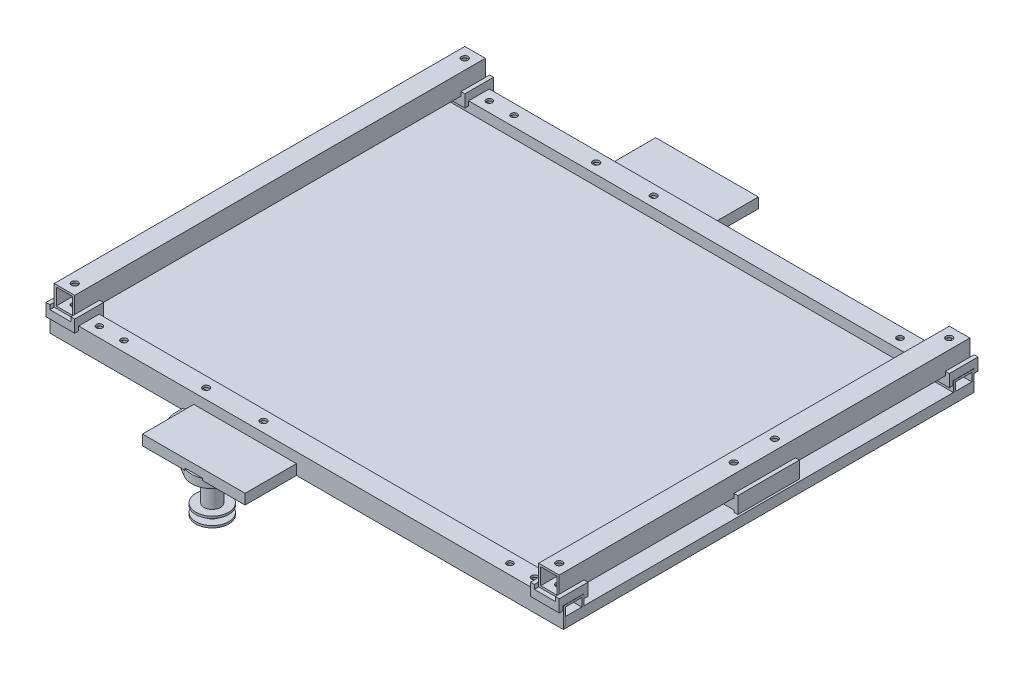
from build123d import *

# Parameters (mm, degrees)
SKETCH_1_W                   = 250
SKETCH_1_H                   = 200
EXTRUDE_1_DEPTH              = 5
SKETCH_2_R                   = 1.5
CUT_EXTRUDE_1_DEPTH          = 161.15617378
SKETCH_3_W                   = 50
SKETCH_3_H                   = 25
EXTRUDE_2_DEPTH              = 5
SKETCH_5_W                   = 10
SKETCH_5_H                   = 10
SKETCH_5_W_2                 = 8
SKETCH_5_H_2                 = 8
EXTRUDE_3_DEPTH              = 250
CUT_EXTRUDE_2_DEPTH          = 177.847391838
CUT_EXTRUDE_2_DEPTH_BACK     = 177.847391838
SKETCH_2_2_R                 = 1.5
SKETCH_7_R                   = 3
SKETCH_7_R_2                 = 1.5
EXTRUDE_4_DEPTH              = 10
SKETCH_7_3_R                 = 3
SKETCH_7_3_R_2               = 1.5
EXTRUDE_5_DEPTH              = 20
SKETCH_7_4_R                 = 4
SKETCH_7_4_R_2               = 3
EXTRUDE_6_DEPTH              = 6
SKETCH_7_5_R                 = 4
SKETCH_7_5_R_2               = 3
EXTRUDE_7_DEPTH              = 16
SKETCH_14_R                  = 8
SKETCH_14_R_2                = 3
EXTRUDE_8_DEPTH              = 1
SKETCH_15_R                  = 8
SKETCH_15_R_2                = 3
EXTRUDE_9_DEPTH              = 1
EXTRUDE_START                = 7
SKETCH_7_6_R                 = 4
SKETCH_7_6_R_2               = 3
EXTRUDE_10_DEPTH             = 3
EXTRUDE_START_2              = 17
SKETCH_7_7_R                 = 4
SKETCH_7_7_R_2               = 3
EXTRUDE_11_DEPTH             = 3
SKETCH_16_R                  = 8
SKETCH_16_R_2                = 1.5
EXTRUDE_12_DEPTH             = 1
SKETCH_17_R                  = 8
SKETCH_17_R_2                = 1.5
EXTRUDE_13_DEPTH             = 1
SKETCH_18_R                  = 1.5
EXTRUDE_14_DEPTH             = 1
SKETCH_18_W                  = 40
SKETCH_18_H                  = 4
EXTRUDE_14_2_DEPTH           = 1
SKETCH_19_R                  = 4.1
EXTRUDE_15_DEPTH             = 3
SKETCH_24_W                  = 1.6
SKETCH_24_H                  = 13
HOLE_WIZARD_M3_1_AT_2_COUNT  = 2
HOLE_WIZARD_M3_1_AT_2_PITCH  = 28
OTHER_START                  = -0.1
OTHER_5_OUTLINE_W            = 40
OTHER_5_OUTLINE_H            = 10.2
OTHER_5_OUTLINE_R            = 1.6
OTHER_5_DEPTH                = 1.1
SKETCH_25_W                  = 10
SKETCH_25_H                  = 10
SKETCH_25_W_2                = 8
SKETCH_25_H_2                = 8
EXTRUDE_16_DEPTH             = 200
EXTRUDE_16_2_DEPTH           = 200
SKETCH_26_W                  = 14
SKETCH_26_H                  = 14
EXTRUDE_18_DEPTH             = 2
SKETCH_27_W                  = 2
SKETCH_27_H                  = 14
EXTRUDE_19_DEPTH             = 2
SKETCH_28_W                  = 14
SKETCH_28_H                  = 2
EXTRUDE_20_DEPTH             = 2
OTHER_START_2                = 10
OTHER_3_OUTLINE_W            = 14
OTHER_3_OUTLINE_H            = 10.2
OTHER_3_DEPTH                = 0.1
OTHER_START_3                = 11.9
OTHER_3_2_OUTLINE_W          = 10.2
OTHER_3_2_OUTLINE_H          = 12.1
OTHER_3_2_DEPTH              = 0.1
OTHER_START_4                = 8
OTHER_3_3_OUTLINE_W          = 14
OTHER_3_3_OUTLINE_H          = 0.1
OTHER_3_3_DEPTH              = 2
OTHER_START_5                = 12
OTHER_3_4_OUTLINE_W          = 0.1
OTHER_3_4_OUTLINE_H          = 12.1
OTHER_3_4_DEPTH              = 2
CUT_EXTRUDE_3_DEPTH          = 1.9
EXTRUDE_21_DEPTH             = 15
HOLE_START                   = 7
HOLE_WIZARD_M3_2_OUTLINE_R   = 1.6
HOLE_WIZARD_M3_2_DEPTH       = 4.9
HOLE_START_2                 = 10.1
HOLE_WIZARD_M3_2_2_OUTLINE_R = 1.6
HOLE_WIZARD_M3_2_2_DEPTH     = 1.8
HOLE_WIZARD_M3_2_3_OUTLINE_R = 1.6
HOLE_WIZARD_M3_2_3_DEPTH     = 1.8
HOLE_WIZARD_M3_2_4_OUTLINE_R = 1.6
HOLE_WIZARD_M3_2_4_DEPTH     = 1.8
HOLE_WIZARD_M3_2_5_OUTLINE_R = 1.6
HOLE_WIZARD_M3_2_5_DEPTH     = 1.8
HOLE_START_3                 = 12
HOLE_WIZARD_M3_2_6_OUTLINE_R = 1.6
HOLE_WIZARD_M3_2_6_DEPTH     = 10
HOLE_WIZARD_M3_2_7_OUTLINE_R = 1.6
HOLE_WIZARD_M3_2_7_DEPTH     = 10
HOLE_WIZARD_M3_2_8_OUTLINE_R = 1.6
HOLE_WIZARD_M3_2_8_DEPTH     = 10
HOLE_WIZARD_M3_2_9_OUTLINE_R = 1.6
HOLE_WIZARD_M3_2_9_DEPTH     = 10


# Read off the part's stored shape, not the designer's step: ｲﾝﾃﾞﾝﾄ5, ｲﾝﾃﾞﾝﾄ3, M3 すきま穴2
with BuildPart() as part:
    # ｽｹｯﾁ1 → ﾎﾞｽ - 押し出し1 (new body)
    with BuildSketch(Plane(origin=(0, 0, 0), x_dir=(1, 0, 0), z_dir=(0, 1, 0))):
        Rectangle(SKETCH_1_W, SKETCH_1_H)
    extrude(amount=EXTRUDE_1_DEPTH)

    # ｽｹｯﾁ2 → ｶｯﾄ - 押し出し1 (cut, through all)
    with BuildSketch(Plane(origin=(0, 5, 0), x_dir=(1, 0, 0), z_dir=(0, 1, 0))):
        with Locations(Location((-106, 95, 0), (0, 0, 270))):
            Circle(SKETCH_2_R)
        with Locations(Location((-94, 95, 0), (0, 0, 270))):
            Circle(SKETCH_2_R)
        with Locations(Location((-94, -95, 0), (0, 0, 90))):
            Circle(SKETCH_2_R)
        with Locations(Location((-106, -95, 0), (0, 0, 90))):
            Circle(SKETCH_2_R)
        with Locations(Location((94, 95, 0), (0, 0, 90))):
            Circle(SKETCH_2_R)
        with Locations(Location((106, 95, 0), (0, 0, 90))):
            Circle(SKETCH_2_R)
        with Locations(Location((94, -95, 0), (0, 0, 270))):
            Circle(SKETCH_2_R)
        with Locations(Location((106, -95, 0), (0, 0, 270))):
            Circle(SKETCH_2_R)
    extrude(amount=-CUT_EXTRUDE_1_DEPTH, mode=Mode.SUBTRACT)

    # ｽｹｯﾁ3 → ﾎﾞｽ - 押し出し2 (add)
    with BuildSketch(Plane(origin=(0, 5, 0), x_dir=(1, 0, 0), z_dir=(0, 1, 0))):
        with Locations((-30, 112.5)):
            Rectangle(SKETCH_3_W, SKETCH_3_H)
        with Locations((-30, -112.5)):
            Rectangle(SKETCH_3_W, SKETCH_3_H)
    extrude(amount=-EXTRUDE_2_DEPTH)


with BuildPart() as body_2:
    # ｽｹｯﾁ5 → ﾎﾞｽ - 押し出し3 (new body)
    with BuildSketch(Plane.ZY.offset(125)):
        with Locations((95, 5)):
            Rectangle(SKETCH_5_W, SKETCH_5_H)
        with Locations((95, 5)):
            Rectangle(SKETCH_5_W_2, SKETCH_5_H_2, mode=Mode.SUBTRACT)
    extrude(amount=-EXTRUDE_3_DEPTH)


with BuildPart() as body_3:
    # ﾐﾗｰ1: mirrored copy
    add(body_2.part.mirror(Plane.XY))


with BuildPart() as cut_extrude_2_tool:
    # ｽｹｯﾁ2<2> → ｶｯﾄ - 押し出し2 (new, two sides: drawn at the far end of the back side and taken through both)
    with BuildSketch(Plane(origin=(0, 5, 0), x_dir=(1, 0, 0), z_dir=(0, 1, 0)).offset(-CUT_EXTRUDE_2_DEPTH_BACK)):
        with Locations(Location((-106, 95, 0), (0, 0, 270))):
            Circle(SKETCH_2_2_R)
        with Locations(Location((-94, 95, 0), (0, 0, 270))):
            Circle(SKETCH_2_2_R)
        with Locations(Location((-94, -95, 0), (0, 0, 270))):
            Circle(SKETCH_2_2_R)
        with Locations(Location((-106, -95, 0), (0, 0, 270))):
            Circle(SKETCH_2_2_R)
        with Locations(Location((94, 95, 0), (0, 0, 270))):
            Circle(SKETCH_2_2_R)
        with Locations(Location((106, 95, 0), (0, 0, 270))):
            Circle(SKETCH_2_2_R)
        with Locations(Location((94, -95, 0), (0, 0, 270))):
            Circle(SKETCH_2_2_R)
        with Locations(Location((106, -95, 0), (0, 0, 270))):
            Circle(SKETCH_2_2_R)
    extrude(amount=CUT_EXTRUDE_2_DEPTH + CUT_EXTRUDE_2_DEPTH_BACK)


with BuildPart() as body_2_1:
    add(body_2.part)

    # ｶｯﾄ - 押し出し2: cut by cut_extrude_2_tool
    add(cut_extrude_2_tool.part, mode=Mode.SUBTRACT)


with BuildPart() as body_3_1:
    add(body_3.part)

    # ｶｯﾄ - 押し出し2: cut by cut_extrude_2_tool
    add(cut_extrude_2_tool.part, mode=Mode.SUBTRACT)

    # Hole Wizard M3 _2 8 outline → Hole Wizard M3 _2 8 (cut)
    with BuildSketch(Plane(origin=(0, 0, 0), x_dir=(1, 0, 0), z_dir=(0, 1, 0))):
        with Locations((-118, 95)):
            Circle(HOLE_WIZARD_M3_2_8_OUTLINE_R)
        with Locations((118, 95)):
            Circle(HOLE_WIZARD_M3_2_8_OUTLINE_R)
        with Locations((-54, 95)):
            Circle(HOLE_WIZARD_M3_2_8_OUTLINE_R)
        with Locations((-26, 95)):
            Circle(HOLE_WIZARD_M3_2_8_OUTLINE_R)
    extrude(amount=HOLE_WIZARD_M3_2_8_DEPTH, mode=Mode.SUBTRACT)


with BuildPart() as body_4:
    # ｽｹｯﾁ7 → ﾎﾞｽ - 押し出し4 (new body)
    with BuildSketch(Plane.XZ):
        with Locations(Location((-50, 104, 0), (0, 0, 270))):
            Circle(SKETCH_7_R)
        with Locations(Location((-50, 104, 0), (0, 0, 270))):
            Circle(SKETCH_7_R_2, mode=Mode.SUBTRACT)
    extrude(amount=EXTRUDE_4_DEPTH)


with BuildPart() as body_5:
    # ｽｹｯﾁ7<3> → ﾎﾞｽ - 押し出し5 (new body)
    with BuildSketch(Plane.XZ):
        with Locations(Location((-30, 116, 0), (0, 0, 270))):
            Circle(SKETCH_7_3_R)
        with Locations(Location((-30, 116, 0), (0, 0, 270))):
            Circle(SKETCH_7_3_R_2, mode=Mode.SUBTRACT)
    extrude(amount=EXTRUDE_5_DEPTH)


with BuildPart() as body_6:
    # ｽｹｯﾁ7<4> → ﾎﾞｽ - 押し出し6 (new body)
    with BuildSketch(Plane.XZ):
        with Locations(Location((-50, 104, 0), (0, 0, 270))):
            Circle(SKETCH_7_4_R)
        with Locations(Location((-50, 104, 0), (0, 0, 270))):
            Circle(SKETCH_7_4_R_2, mode=Mode.SUBTRACT)
    extrude(amount=EXTRUDE_6_DEPTH)


with BuildPart() as body_7:
    # ｽｹｯﾁ7<5> → ﾎﾞｽ - 押し出し7 (new body)
    with BuildSketch(Plane.XZ):
        with Locations(Location((-30, 116, 0), (0, 0, 270))):
            Circle(SKETCH_7_5_R)
        with Locations(Location((-30, 116, 0), (0, 0, 270))):
            Circle(SKETCH_7_5_R_2, mode=Mode.SUBTRACT)
    extrude(amount=EXTRUDE_7_DEPTH)


with BuildPart() as body_8:
    # ｽｹｯﾁ14 → ﾎﾞｽ - 押し出し8 (new body)
    with BuildSketch(Plane.XZ.offset(6)):
        with Locations(Location((-50, 104, 0), (0, 0, 270))):
            Circle(SKETCH_14_R)
        with Locations(Location((-50, 104, 0), (0, 0, 270))):
            Circle(SKETCH_14_R_2, mode=Mode.SUBTRACT)
    extrude(amount=EXTRUDE_8_DEPTH)


with BuildPart() as body_9:
    # ｽｹｯﾁ15 → ﾎﾞｽ - 押し出し9 (new body)
    with BuildSketch(Plane.XZ.offset(16)):
        with Locations(Location((-30, 116, 0), (0, 0, 270))):
            Circle(SKETCH_15_R)
        with Locations(Location((-30, 116, 0), (0, 0, 270))):
            Circle(SKETCH_15_R_2, mode=Mode.SUBTRACT)
    extrude(amount=EXTRUDE_9_DEPTH)


with BuildPart() as body_10:
    # ｽｹｯﾁ7<6> → ﾎﾞｽ - 押し出し10 (new body)
    with BuildSketch(Plane.XZ.offset(EXTRUDE_START)):
        with Locations(Location((-50, 104, 0), (0, 0, 270))):
            Circle(SKETCH_7_6_R)
        with Locations(Location((-50, 104, 0), (0, 0, 270))):
            Circle(SKETCH_7_6_R_2, mode=Mode.SUBTRACT)
    extrude(amount=EXTRUDE_10_DEPTH)


with BuildPart() as body_11:
    # ｽｹｯﾁ7<7> → ﾎﾞｽ - 押し出し11 (new body)
    with BuildSketch(Plane.XZ.offset(EXTRUDE_START_2)):
        with Locations(Location((-30, 116, 0), (0, 0, 270))):
            Circle(SKETCH_7_7_R)
        with Locations(Location((-30, 116, 0), (0, 0, 270))):
            Circle(SKETCH_7_7_R_2, mode=Mode.SUBTRACT)
    extrude(amount=EXTRUDE_11_DEPTH)


with BuildPart() as body_12:
    # ｽｹｯﾁ16 → ﾎﾞｽ - 押し出し12 (new body)
    with BuildSketch(Plane.XZ.offset(10)):
        with Locations(Location((-50, 104, 0), (0, 0, 270))):
            Circle(SKETCH_16_R)
        with Locations(Location((-50, 104, 0), (0, 0, 270))):
            Circle(SKETCH_16_R_2, mode=Mode.SUBTRACT)
    extrude(amount=EXTRUDE_12_DEPTH)


with BuildPart() as body_13:
    # ｽｹｯﾁ17 → ﾎﾞｽ - 押し出し13 (new body)
    with BuildSketch(Plane.XZ.offset(20)):
        with Locations(Location((-30, 116, 0), (0, 0, 270))):
            Circle(SKETCH_17_R)
        with Locations(Location((-30, 116, 0), (0, 0, 270))):
            Circle(SKETCH_17_R_2, mode=Mode.SUBTRACT)
    extrude(amount=EXTRUDE_13_DEPTH)


with BuildPart() as body_14:
    # ｽｹｯﾁ18 → ﾎﾞｽ - 押し出し14 (new body)
    with BuildSketch(Plane.XZ):
        with BuildLine():
            Line((-60, 100), (-60, 104))
            ThreePointArc((-60, 104), (-58.701999068, 108.92698815), (-55.144957554, 112.574929257))
            Line((-55.144957554, 112.574929257), (-35.144957554, 124.574929257))
            ThreePointArc((-35.144957554, 124.574929257), (-25.07301185, 124.701999068), (-20, 116))
            Line((-20, 116), (-20, 100))
            Line((-20, 100), (-60, 100))
        make_face()
        with Locations(Location((-50, 104, 0), (0, 0, 270))):
            Circle(SKETCH_18_R, mode=Mode.SUBTRACT)
        with Locations(Location((-30, 116, 0), (0, 0, 270))):
            Circle(SKETCH_18_R, mode=Mode.SUBTRACT)
    extrude(amount=-EXTRUDE_14_DEPTH)


with BuildPart() as body_15:
    # ｽｹｯﾁ18 → Extrude 14 2 (new body)
    with BuildSketch(Plane.XZ):
        with Locations((-40, 88)):
            Rectangle(SKETCH_18_W, SKETCH_18_H)
    extrude(amount=-EXTRUDE_14_2_DEPTH)


    add(body_14.part)  # ﾎﾞｽ - 押し出し15 merges body 14
    # ｽｹｯﾁ19 → ﾎﾞｽ - 押し出し15 (add)
    with BuildSketch(Plane.XZ):
        with BuildLine():
            Line((-60, 100), (-60, 86))
            Line((-60, 86), (-20, 86))
            Line((-20, 86), (-20, 100))
            Line((-20, 100), (-20, 116))
            ThreePointArc((-20, 116), (-25.07301185, 124.701999068), (-35.144957554, 124.574929257))
            Line((-35.144957554, 124.574929257), (-55.144957554, 112.574929257))
            ThreePointArc((-55.144957554, 112.574929257), (-58.701999068, 108.92698815), (-60, 104))
            Line((-60, 104), (-60, 100))
        make_face()
        with Locations(Location((-30, 116, 0), (0, 0, 270))):
            Circle(SKETCH_19_R, mode=Mode.SUBTRACT)
        with Locations(Location((-50, 104, 0), (0, 0, 257.319616508))):
            Circle(SKETCH_19_R, mode=Mode.SUBTRACT)
    extrude(amount=EXTRUDE_15_DEPTH)


with BuildPart() as hole_wizard_m3_1_tool:
    # ｽｹｯﾁ24 → M3 すきま穴1 (revolve)
    with BuildSketch(Plane(origin=(-54, -3, 95), x_dir=(0, 0, -1), z_dir=(1, 0, 0))):
        with Locations((0.8, 6.5)):
            Rectangle(SKETCH_24_W, SKETCH_24_H)
    hole_wizard_m3_1 = revolve(axis=Axis((-54, -9.35, 95), (0, 1, 0)))


with BuildPart() as body_2_2:
    add(body_2_1.part)

    # M3 すきま穴1: cut by hole_wizard_m3_1_tool
    add(hole_wizard_m3_1_tool.part, mode=Mode.SUBTRACT)


with BuildPart() as body_15_1:
    add(body_15.part)

    # M3 すきま穴1: cut by hole_wizard_m3_1_tool
    add(hole_wizard_m3_1_tool.part, mode=Mode.SUBTRACT)


with BuildPart() as hole_wizard_m3_1_at_2_tool:
    # M3 すきま穴1 at 2: M3 すきま穴1 ×2
    with Locations(*[(i * HOLE_WIZARD_M3_1_AT_2_PITCH, 0, 0) for i in range(1, HOLE_WIZARD_M3_1_AT_2_COUNT)]):
        add(hole_wizard_m3_1)


with BuildPart() as body_2_3:
    add(body_2_2.part)

    # M3 すきま穴1 at 2: cut by hole_wizard_m3_1_at_2_tool
    add(hole_wizard_m3_1_at_2_tool.part, mode=Mode.SUBTRACT)

    # Hole Wizard M3 _2 9 outline → Hole Wizard M3 _2 9 (cut)
    with BuildSketch(Plane(origin=(0, 0, 0), x_dir=(1, 0, 0), z_dir=(0, 1, 0))):
        with Locations((118, -95)):
            Circle(HOLE_WIZARD_M3_2_9_OUTLINE_R)
        with Locations((-118, -95)):
            Circle(HOLE_WIZARD_M3_2_9_OUTLINE_R)
    extrude(amount=HOLE_WIZARD_M3_2_9_DEPTH, mode=Mode.SUBTRACT)


with BuildPart() as body_15_2:
    add(body_15_1.part)

    # M3 すきま穴1 at 2: cut by hole_wizard_m3_1_at_2_tool
    add(hole_wizard_m3_1_at_2_tool.part, mode=Mode.SUBTRACT)

    # ｲﾝﾃﾞﾝﾄ5 outline → ｲﾝﾃﾞﾝﾄ5 (cut)
    with BuildSketch(Plane(origin=(0, 0, 0), x_dir=(1, 0, 0), z_dir=(0, 1, 0)).offset(OTHER_START)):
        with Locations((-40, -95)):
            Rectangle(OTHER_5_OUTLINE_W, OTHER_5_OUTLINE_H)
        with BuildLine():
            ThreePointArc((-50.9, -100), (-50, -99.9), (-49.1, -100))
            Line((-49.1, -100), (-50.9, -100))
        make_face(mode=Mode.SUBTRACT)
        with Locations((-26, -95)):
            Circle(OTHER_5_OUTLINE_R, mode=Mode.SUBTRACT)
        with Locations((-54, -95)):
            Circle(OTHER_5_OUTLINE_R, mode=Mode.SUBTRACT)
    extrude(amount=OTHER_5_DEPTH, mode=Mode.SUBTRACT)


with BuildPart() as body_15_2_1:
    # ｽｹｯﾁ25 → ﾎﾞｽ - 押し出し16 (new body)
    with BuildSketch(Plane.XY.offset(100)):
        with Locations((-118, 17)):
            Rectangle(SKETCH_25_W, SKETCH_25_H)
        with Locations((-118, 17)):
            Rectangle(SKETCH_25_W_2, SKETCH_25_H_2, mode=Mode.SUBTRACT)
    extrude(amount=-EXTRUDE_16_DEPTH)

    # Hole Wizard M3 _2 7 outline → Hole Wizard M3 _2 7 (cut)
    with BuildSketch(Plane(origin=(0, 0, 0), x_dir=(1, 0, 0), z_dir=(0, 1, 0)).offset(HOLE_START_3)):
        with Locations((-118, 95)):
            Circle(HOLE_WIZARD_M3_2_7_OUTLINE_R)
        with Locations((-118, -95)):
            Circle(HOLE_WIZARD_M3_2_7_OUTLINE_R)
    extrude(amount=HOLE_WIZARD_M3_2_7_DEPTH, mode=Mode.SUBTRACT)


with BuildPart() as body_16:
    # ｽｹｯﾁ25 → Extrude 16 2 (new body)
    with BuildSketch(Plane.XY.offset(100)):
        with Locations((118, 17)):
            Rectangle(SKETCH_25_W, SKETCH_25_H)
        with Locations((118, 17)):
            Rectangle(SKETCH_25_W_2, SKETCH_25_H_2, mode=Mode.SUBTRACT)
    extrude(amount=-EXTRUDE_16_2_DEPTH)

    # Hole Wizard M3 _2 6 outline → Hole Wizard M3 _2 6 (cut)
    with BuildSketch(Plane(origin=(0, 0, 0), x_dir=(1, 0, 0), z_dir=(0, 1, 0)).offset(HOLE_START_3)):
        with Locations((118, -10)):
            Circle(HOLE_WIZARD_M3_2_6_OUTLINE_R)
        with Locations((118, 10)):
            Circle(HOLE_WIZARD_M3_2_6_OUTLINE_R)
        with Locations((118, -95)):
            Circle(HOLE_WIZARD_M3_2_6_OUTLINE_R)
        with Locations((118, 95)):
            Circle(HOLE_WIZARD_M3_2_6_OUTLINE_R)
    extrude(amount=HOLE_WIZARD_M3_2_6_DEPTH, mode=Mode.SUBTRACT)


with BuildPart() as body_17:
    # ｽｹｯﾁ26 → ﾎﾞｽ - 押し出し18 (new body)
    with BuildSketch(Plane(origin=(0, 10, 0), x_dir=(1, 0, 0), z_dir=(0, 1, 0))):
        with Locations((-118, -95)):
            Rectangle(SKETCH_26_W, SKETCH_26_H)
    extrude(amount=EXTRUDE_18_DEPTH)

    # ｽｹｯﾁ27 → ﾎﾞｽ - 押し出し19 (add)
    with BuildSketch(Plane(origin=(0, 12, 0), x_dir=(1, 0, 0), z_dir=(0, 1, 0))):
        with Locations((-124, -95)):
            Rectangle(SKETCH_27_W, SKETCH_27_H)
        with Locations((-112, -95)):
            Rectangle(SKETCH_27_W, SKETCH_27_H)
    extrude(amount=EXTRUDE_19_DEPTH)

    # ｽｹｯﾁ28 → ﾎﾞｽ - 押し出し20 (add)
    with BuildSketch(Plane.XZ.offset(-10)):
        with Locations((-118, 101)):
            Rectangle(SKETCH_28_W, SKETCH_28_H)
        with Locations((-118, 89)):
            Rectangle(SKETCH_28_W, SKETCH_28_H)
    extrude(amount=EXTRUDE_20_DEPTH)

    # ｲﾝﾃﾞﾝﾄ3 outline → ｲﾝﾃﾞﾝﾄ3 (cut)
    with BuildSketch(Plane(origin=(0, 0, 0), x_dir=(1, 0, 0), z_dir=(0, 1, 0)).offset(OTHER_START_2)):
        with Locations((-118, -95)):
            Rectangle(OTHER_3_OUTLINE_W, OTHER_3_OUTLINE_H)
    extrude(amount=OTHER_3_DEPTH, mode=Mode.SUBTRACT)

    # Other 3 2 outline → Other 3 2 (cut)
    with BuildSketch(Plane(origin=(0, 0, 0), x_dir=(1, 0, 0), z_dir=(0, 1, 0)).offset(OTHER_START_3)):
        with Locations((-118, -94.05)):
            Rectangle(OTHER_3_2_OUTLINE_W, OTHER_3_2_OUTLINE_H)
    extrude(amount=OTHER_3_2_DEPTH, mode=Mode.SUBTRACT)

    # Other 3 3 outline → Other 3 3 (cut)
    with BuildSketch(Plane(origin=(0, 0, 0), x_dir=(1, 0, 0), z_dir=(0, 1, 0)).offset(OTHER_START_4)):
        with Locations((-118, -89.95)):
            Rectangle(OTHER_3_3_OUTLINE_W, OTHER_3_3_OUTLINE_H)
        with Locations((-118, -100.05)):
            Rectangle(OTHER_3_3_OUTLINE_W, OTHER_3_3_OUTLINE_H)
    extrude(amount=OTHER_3_3_DEPTH, mode=Mode.SUBTRACT)

    # Other 3 4 outline → Other 3 4 (cut)
    with BuildSketch(Plane(origin=(0, 0, 0), x_dir=(1, 0, 0), z_dir=(0, 1, 0)).offset(OTHER_START_5)):
        with Locations((-123.05, -94.05)):
            Rectangle(OTHER_3_4_OUTLINE_W, OTHER_3_4_OUTLINE_H)
        with Locations((-112.95, -94.05)):
            Rectangle(OTHER_3_4_OUTLINE_W, OTHER_3_4_OUTLINE_H)
    extrude(amount=OTHER_3_4_DEPTH, mode=Mode.SUBTRACT)

    # ｽｹｯﾁ35 → ｶｯﾄ - 押し出し3 (cut)
    with BuildSketch(Plane(origin=(0, 0, 100.1), x_dir=(-1, 0, 0), z_dir=(0, 0, -1))):
        Polygon((123, 14), (123, 12), (113, 12), (113, 14), (112.9, 14), (112.9, 11.9), (123.1, 11.9), (123.1, 14), align=None)
    extrude(amount=-CUT_EXTRUDE_3_DEPTH, mode=Mode.SUBTRACT)


with BuildPart() as body_18:
    # ﾐﾗｰ2: mirrored copy
    add(body_17.part.mirror(Plane(origin=(0, 0, 0), x_dir=(0, 0, 1), z_dir=(1, 0, 0))))


with BuildPart() as body_19:
    # ﾐﾗｰ3: mirrored copy
    add(body_17.part.mirror(Plane.XY))

    # Hole Wizard M3 _2 3 outline → Hole Wizard M3 _2 3 (cut)
    with BuildSketch(Plane(origin=(0, 0, 0), x_dir=(1, 0, 0), z_dir=(0, 1, 0)).offset(HOLE_START_2)):
        with Locations((-118, 95)):
            Circle(HOLE_WIZARD_M3_2_3_OUTLINE_R)
    extrude(amount=HOLE_WIZARD_M3_2_3_DEPTH, mode=Mode.SUBTRACT)


with BuildPart() as body_20:
    # Mirror 3 2: mirrored copy
    add(body_9.part.mirror(Plane.XY))


with BuildPart() as body_21:
    # Mirror 3 3: mirrored copy
    add(body_8.part.mirror(Plane.XY))


with BuildPart() as body_22:
    # Mirror 3 4: mirrored copy
    add(body_11.part.mirror(Plane.XY))


with BuildPart() as body_23:
    # Mirror 3 5: mirrored copy
    add(body_7.part.mirror(Plane.XY))


with BuildPart() as body_24:
    # Mirror 3 6: mirrored copy
    add(body_10.part.mirror(Plane.XY))


with BuildPart() as body_25:
    # Mirror 3 7: mirrored copy
    add(body_13.part.mirror(Plane.XY))


with BuildPart() as body_26:
    # Mirror 3 8: mirrored copy
    add(body_5.part.mirror(Plane.XY))


with BuildPart() as body_27:
    # Mirror 3 9: mirrored copy
    add(body_12.part.mirror(Plane.XY))


with BuildPart() as body_28:
    # Mirror 3 10: mirrored copy
    add(body_15_2.part.mirror(Plane.XY))


with BuildPart() as body_29:
    # Mirror 3 11: mirrored copy
    add(body_6.part.mirror(Plane.XY))


with BuildPart() as body_30:
    # Mirror 3 12: mirrored copy
    add(body_18.part.mirror(Plane.XY))

    # Hole Wizard M3 _2 2 outline → Hole Wizard M3 _2 2 (cut)
    with BuildSketch(Plane(origin=(0, 0, 0), x_dir=(1, 0, 0), z_dir=(0, 1, 0)).offset(HOLE_START_2)):
        with Locations((118, 95)):
            Circle(HOLE_WIZARD_M3_2_2_OUTLINE_R)
    extrude(amount=HOLE_WIZARD_M3_2_2_DEPTH, mode=Mode.SUBTRACT)


with BuildPart() as body_31:
    # Mirror 3 13: mirrored copy
    add(body_4.part.mirror(Plane.XY))


with BuildPart() as body_32:
    # ｽｹｯﾁ34 → ﾎﾞｽ - 押し出し21 (new, symmetric)
    with BuildSketch(Plane.XY):
        Polygon((111, 14), (111, 6), (112.9, 6), (112.9, 7), (123.1, 7), (123.1, 6), (125, 6), (125, 14), (123.1, 14), (123.1, 11.9), (112.9, 11.9), (112.9, 14), align=None)
    extrude(amount=EXTRUDE_21_DEPTH, both=True)

    # M3 すきま穴2 outline → M3 すきま穴2 (cut)
    with BuildSketch(Plane(origin=(0, 0, 0), x_dir=(1, 0, 0), z_dir=(0, 1, 0)).offset(HOLE_START)):
        with Locations((118, -10)):
            Circle(HOLE_WIZARD_M3_2_OUTLINE_R)
        with Locations((118, 10)):
            Circle(HOLE_WIZARD_M3_2_OUTLINE_R)
    extrude(amount=HOLE_WIZARD_M3_2_DEPTH, mode=Mode.SUBTRACT)


with BuildPart() as body_18_1:
    add(body_18.part)

    # Hole Wizard M3 _2 4 outline → Hole Wizard M3 _2 4 (cut)
    with BuildSketch(Plane(origin=(0, 0, 0), x_dir=(1, 0, 0), z_dir=(0, 1, 0)).offset(HOLE_START_2)):
        with Locations((118, -95)):
            Circle(HOLE_WIZARD_M3_2_4_OUTLINE_R)
    extrude(amount=HOLE_WIZARD_M3_2_4_DEPTH, mode=Mode.SUBTRACT)


with BuildPart() as body_17_1:
    add(body_17.part)

    # Hole Wizard M3 _2 5 outline → Hole Wizard M3 _2 5 (cut)
    with BuildSketch(Plane(origin=(0, 0, 0), x_dir=(1, 0, 0), z_dir=(0, 1, 0)).offset(HOLE_START_2)):
        with Locations((-118, -95)):
            Circle(HOLE_WIZARD_M3_2_5_OUTLINE_R)
    extrude(amount=HOLE_WIZARD_M3_2_5_DEPTH, mode=Mode.SUBTRACT)


solid = Compound([part.part, body_3_1.part, body_4.part, body_5.part, body_6.part, body_7.part, body_8.part, body_9.part, body_10.part, body_11.part, body_12.part, body_13.part, body_2_3.part, body_15_2.part, body_15_2_1.part, body_16.part, body_19.part, body_20.part, body_21.part, body_22.part, body_23.part, body_24.part, body_25.part, body_26.part, body_27.part, body_28.part, body_29.part, body_30.part, body_31.part, body_32.part, body_18_1.part, body_17_1.part])
